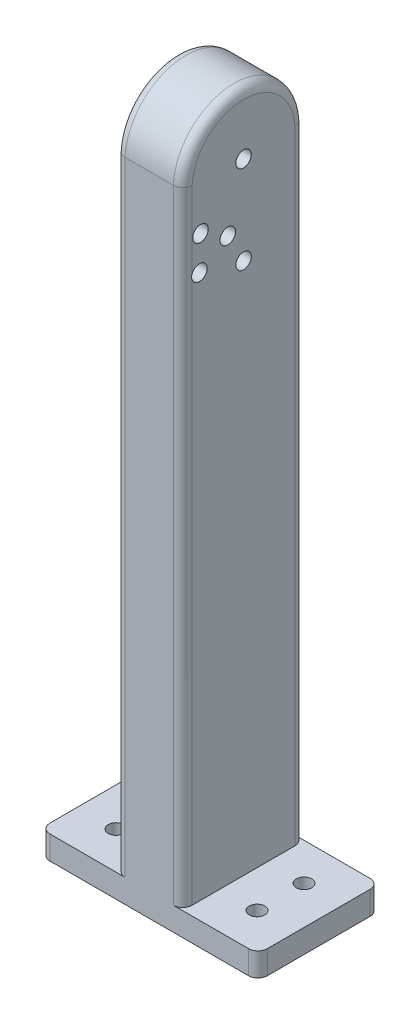
from build123d import *

# Parameters (mm, degrees)
BOSS_EXTRUDE1_DEPTH            = 46.27
CUT_EXTRUDE1_START             = -16
CUT_EXTRUDE1_DEPTH             = 16
SKETCH3_W                      = 16
SKETCH3_H                      = 25.869839341
CUT_EXTRUDE2_DEPTH             = 149.547898757
F_3_3_3_3_DIAMETER_HOLE2_D     = 3.3
F_3_3_3_3_DIAMETER_HOLE2_DEPTH = 30.27
FILLET1_START                  = -31.325217542
FILLET1_OUTLINE_W              = 14.27
FILLET1_OUTLINE_H              = 25.869839341
FILLET1_DEPTH                  = 12.325217542
FILLET1_START_2                = -164
FILLET1_2_DEPTH                = 136.422667769
FILLET1_START_3                = -170
FILLET1_3_DEPTH                = 133.08200918
FILLET1_4_ANGLE                = 174.469297
SKETCH9_R                      = 1.65
CUT_EXTRUDE4_DEPTH             = 149.547898869


with BuildPart() as part:
    # Sketch1 → Boss-Extrude1 (new body)
    with BuildSketch(Plane(origin=(23.135, 0, 0), x_dir=(0, 0, -1), z_dir=(1, 0, 0))):
        with BuildLine():
            Line((3.369839341, -169), (3.369839341, -31.325217542))
            ThreePointArc((3.369839341, -31.325217542), (-9.56508033, -19), (-22.5, -31.325217542))
            Line((-22.5, -31.325217542), (-22.5, -169))
            Line((-22.5, -169), (3.369839341, -169))
        make_face()
    extrude(amount=-BOSS_EXTRUDE1_DEPTH)

    # Sketch2 → Cut-Extrude1 (cut)
    with BuildSketch(Plane.ZY.offset(23.135).offset(CUT_EXTRUDE1_START)):
        with BuildLine():
            Line((-3.369839341, -31.325217542), (-3.369839341, -164))
            Line((-3.369839341, -164), (22.5, -164))
            Line((22.5, -164), (22.5, -31.325217542))
            ThreePointArc((22.5, -31.325217542), (9.56508033, -19), (-3.369839341, -31.325217542))
        make_face()
    extrude(amount=CUT_EXTRUDE1_DEPTH, mode=Mode.SUBTRACT)

    # Sketch3 → Cut-Extrude2 (cut, through all)
    with BuildSketch(Plane.XZ.offset(164)):
        with Locations((15.135, 9.56508033)):
            Rectangle(SKETCH3_W, SKETCH3_H)
    extrude(amount=-CUT_EXTRUDE2_DEPTH, mode=Mode.SUBTRACT)

    # Ø3.3 (3.3) Diameter Hole2
    with Locations(Plane(origin=(7.135, 0, 0), x_dir=(0, 0, -1), z_dir=(1, 0, 0))):
        with Locations((-9.56508033, -31.95), (-12.916786964, -44.45873945), (-9.56508033, -50.725), (-18.95258033, -48.209626956), (-18.722113146, -41.107032816)):
            Hole(F_3_3_3_3_DIAMETER_HOLE2_D / 2, depth=F_3_3_3_3_DIAMETER_HOLE2_DEPTH)

    # Fillet1: read off the stored shape, not the designer's step
    # Fillet1 outline → Fillet1 (cut)
    with BuildSketch(Plane(origin=(0, 0, 0), x_dir=(1, 0, 0), z_dir=(0, 1, 0)).offset(FILLET1_START)):
        with Locations((0, -9.56508033)):
            Rectangle(FILLET1_OUTLINE_W, FILLET1_OUTLINE_H)
    extrude(amount=FILLET1_DEPTH, mode=Mode.SUBTRACT)

    # Fillet1 2 outline → Fillet1 2 (cut)
    with BuildSketch(Plane(origin=(0, 0, 0), x_dir=(1, 0, 0), z_dir=(0, 1, 0)).offset(FILLET1_START_2)):
        with BuildLine():
            Line((7.135, 1.369839341), (7.135, 3.369839341))
            Line((7.135, 3.369839341), (5.135, 3.369839341))
            ThreePointArc((5.135, 3.369839341), (6.549213562, 2.784052903), (7.135, 1.369839341))
        make_face()
        with BuildLine():
            Line((5.135, -22.5), (7.135, -22.5))
            Line((7.135, -22.5), (7.135, -20.5))
            ThreePointArc((7.135, -20.5), (6.549213562, -21.914213562), (5.135, -22.5))
        make_face()
        with BuildLine():
            ThreePointArc((-7.135, 1.369839341), (-6.549213562, 2.784052903), (-5.135, 3.369839341))
            Line((-5.135, 3.369839341), (-7.135, 3.369839341))
            Line((-7.135, 3.369839341), (-7.135, 1.369839341))
        make_face()
        with BuildLine():
            Line((-7.135, -22.5), (-5.135, -22.5))
            ThreePointArc((-5.135, -22.5), (-6.549213562, -21.914213562), (-7.135, -20.5))
            Line((-7.135, -20.5), (-7.135, -22.5))
        make_face()
    extrude(amount=FILLET1_2_DEPTH, mode=Mode.SUBTRACT)

    # Fillet1 3 outline → Fillet1 3 (cut)
    with BuildSketch(Plane(origin=(0, 0, 0), x_dir=(1, 0, 0), z_dir=(0, 1, 0)).offset(FILLET1_START_3)):
        with BuildLine():
            ThreePointArc((21.135, 3.369839341), (22.549213562, 2.784052903), (23.135, 1.369839341))
            Line((23.135, 1.369839341), (23.135, 3.369839341))
            Line((23.135, 3.369839341), (21.135, 3.369839341))
        make_face()
        with BuildLine():
            Line((23.135, -22.5), (23.135, -20.5))
            ThreePointArc((23.135, -20.5), (22.549213562, -21.914213562), (21.135, -22.5))
            Line((21.135, -22.5), (23.135, -22.5))
        make_face()
        with BuildLine():
            ThreePointArc((-23.135, 1.369839341), (-22.549213562, 2.784052903), (-21.135, 3.369839341))
            Line((-21.135, 3.369839341), (-23.135, 3.369839341))
            Line((-23.135, 3.369839341), (-23.135, 1.369839341))
        make_face()
        with BuildLine():
            Line((-23.135, -22.5), (-21.135, -22.5))
            ThreePointArc((-21.135, -22.5), (-22.549213562, -21.914213562), (-23.135, -20.5))
            Line((-23.135, -20.5), (-23.135, -22.5))
        make_face()
    extrude(amount=FILLET1_3_DEPTH, mode=Mode.SUBTRACT)

    # Fillet1 4 outline → Fillet1 4 (revolve)
    with BuildSketch(Plane(origin=(0, -31.95, 9.56508033), x_dir=(0, 0.04824574937689506, -0.9988354957985133), z_dir=(0, -0.9988354957985133, -0.04824574937689506))):
        with BuildLine():
            ThreePointArc((10.95, -7.135), (12.364213562, -6.549213562), (12.95, -5.135))
            Line((12.95, -5.135), (12.95, 5.135))
            ThreePointArc((12.95, 5.135), (12.364213562, 6.549213562), (10.95, 7.135))
            Line((10.95, 7.135), (1.65, 7.135))
            Line((1.65, 7.135), (1.65, -7.135))
            Line((1.65, -7.135), (10.95, -7.135))
        make_face()
    revolve(axis=Axis((0, -31.95, 9.56508033), (1, 0, 0)), revolution_arc=FILLET1_4_ANGLE)

    # Sketch9 → Cut-Extrude4 (cut, through all)
    with BuildSketch(Plane(origin=(0, -164, 0), x_dir=(1, 0, 0), z_dir=(0, 1, 0))):
        with Locations(Location((-15, -4.566903162, 0), (0, 0, 270))):
            Circle(SKETCH9_R)
        with Locations(Location((-15, -14.563257497, 0), (0, 0, 90))):
            Circle(SKETCH9_R)
        with Locations(Location((15, -14.563257497, 0), (0, 0, 270))):
            Circle(SKETCH9_R)
        with Locations(Location((15, -4.566903162, 0), (0, 0, 90))):
            Circle(SKETCH9_R)
    extrude(amount=-CUT_EXTRUDE4_DEPTH, mode=Mode.SUBTRACT)


solid = part.part
